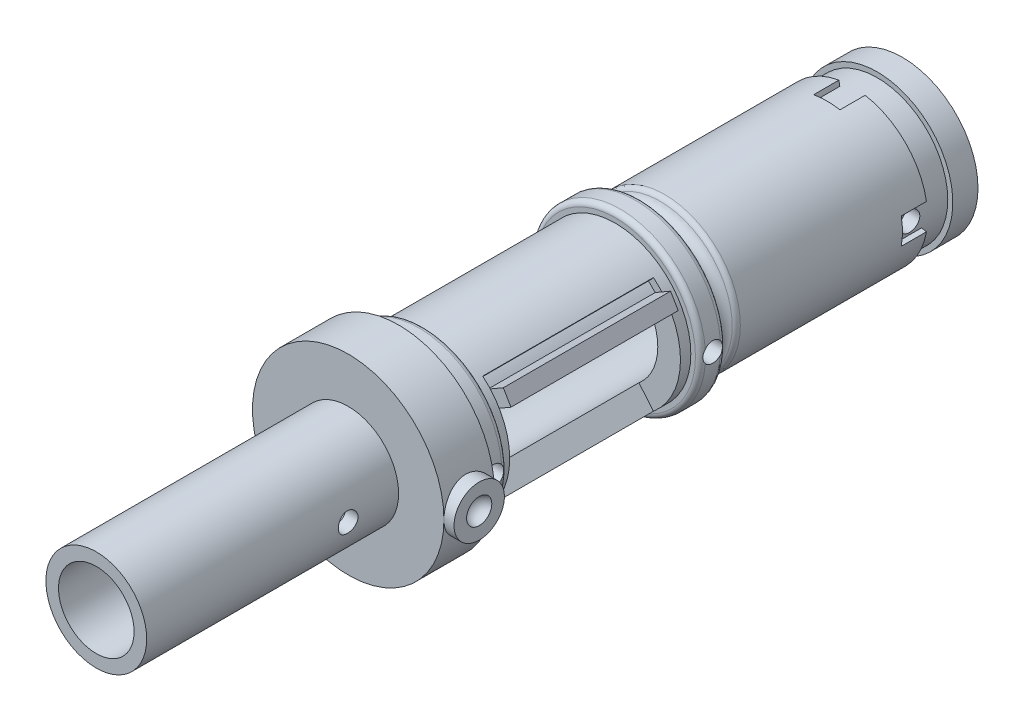
from build123d import *
from build123d.topology import SkipClean

# Parameters (mm, degrees)
ESQUISSE1_R                                   = 15
ESQUISSE1_R_2                                 = 10.5
BOSS_EXTRU_3_DEPTH                            = 100
ESQUISSE9_W                                   = 5
ESQUISSE9_H                                   = 2
ENL_VEMENT_START                              = 10
ENL_VEMENT_DE_MATI_RE_R_VOLUTION2_DEPTH       = 5
R_P_TITION_CIRCULAIRE1_COUNT                  = 4
ESQUISSE11_R                                  = 2
ESQUISSE12_W                                  = 4
ESQUISSE12_H                                  = 5
ESQUISSE13_W                                  = 3
ESQUISSE13_H                                  = 5
CONG_2_R                                      = 1
CONG_3_R                                      = 1
CONG_4_R                                      = 1
CONG_5_R                                      = 1
ENL_V_MAT_EXTRU_2_DEPTH                       = 103.824588457
ENL_V_MAT_EXTRU_2_DEPTH_BACK                  = 103.824588457
ESQUISSE16_R                                  = 1.95
ESQUISSE19_W                                  = 13.434398634
ESQUISSE19_H                                  = 33.894617108
ENL_VEMENT_DE_MATI_RE_R_VOLUTION4_ANGLE       = 50
ENL_VEMENT_DE_MATI_RE_R_VOLUTION4_OTHER_ANGLE = 50
ESQUISSE20_W                                  = 33.894617108
ESQUISSE20_H                                  = 2.5
ESQUISSE25_R                                  = 1.95
ENL_V_MAT_EXTRU_3_DEPTH                       = 103.824588457
BOSS_EXTRU_4_DEPTH                            = 33.894617109
ESQUISSE29_W                                  = 33.894617108
ESQUISSE29_H                                  = 3.1234995
ENL_VEMENT_DE_MATI_RE_R_VOLUTION7_ANGLE       = 100
ESQUISSE32_W                                  = 33.2
ESQUISSE32_H                                  = 2.5
R_VOLUTION4_ANGLE                             = 20
R_VOLUTION4_OTHER_WAY_ANGLE                   = 90
BOSS_EXTRU_5_DEPTH                            = 4
BOSS_EXTRU_5_DEPTH_BACK                       = 1
ESQUISSE34_W                                  = 3
ESQUISSE34_H                                  = 33.2
ESQUISSE35_R                                  = 19
BOSS_EXTRU_6_DEPTH                            = 10
ESQUISSE36_R                                  = 10
ESQUISSE36_R_2                                = 7.5
BOSS_EXTRU_7_DEPTH                            = 50
ESQUISSE39_R                                  = 5
BOSS_EXTRU_8_DEPTH                            = 21
ENL_V_MAT_EXTRU_4_DEPTH                       = 163.486922575
ENL_V_MAT_EXTRU_4_DEPTH_BACK                  = 163.486922575
ESQUISSE42_R                                  = 1.95


# Read off the part's stored shape, not the designer's step: Enlèvement de matière-Révolution2, Boss.-Extru.4
with BuildPart() as part:
    # Esquisse1 → Boss.-Extru.3 (new body)
    with BuildSketch(Plane.XY):
        Circle(ESQUISSE1_R)
        Circle(ESQUISSE1_R_2, mode=Mode.SUBTRACT)
    extrude(amount=BOSS_EXTRU_3_DEPTH)

    # Esquisse9 → Enlèvement de matière-Révolution1 (revolve, cut)
    with BuildSketch(Plane(origin=(0, 0, 0), x_dir=(0, 0, -1), z_dir=(1, 0, 0)), mode=Mode.PRIVATE) as enl_vement_de_mati_re_r_volution1_sk:
        with Locations((-7.5, -15)):
            Rectangle(ESQUISSE9_W, ESQUISSE9_H)
    revolve(enl_vement_de_mati_re_r_volution1_sk.sketch.rotate(Axis((0, 0, 100), (0, 0, -1)), 270), axis=Axis((0, 0, 100), (0, 0, -1)), mode=Mode.SUBTRACT)

    # Enlèvement de matière-Révolution2 outlin → Enlèvement de matière-Révolution2 (cut)
    with BuildSketch(Plane.XY.offset(ENL_VEMENT_START)):
        with BuildLine():
            Line((-2.431074487, -13.787308542), (-2.604722665, -14.772116295))
            ThreePointArc((-2.604722665, -14.772116295), (0, -15), (2.604722665, -14.772116295))
            Line((2.604722665, -14.772116295), (2.431074487, -13.787308542))
            ThreePointArc((2.431074487, -13.787308542), (0, -14), (-2.431074487, -13.787308542))
        make_face()
    enl_vement_de_mati_re_r_volution2 = extrude(amount=ENL_VEMENT_DE_MATI_RE_R_VOLUTION2_DEPTH, mode=Mode.SUBTRACT)

    # Répétition circulaire1: Enlèvement de matière-Révolution2 ×4 about axis
    r_p_tition_circulaire1_axis = Axis((0, 0, 0), (0, 0, 1))
    for i in range(1, R_P_TITION_CIRCULAIRE1_COUNT):
        add(enl_vement_de_mati_re_r_volution2.rotate(r_p_tition_circulaire1_axis, i * 360 / R_P_TITION_CIRCULAIRE1_COUNT), mode=Mode.SUBTRACT)

    # Esquisse11 → Enlèvement de matière-Révolution3 (revolve, cut)
    with BuildSketch(Plane(origin=(0, 0, 0), x_dir=(1, 0, 0), z_dir=(0, 1, 0)), mode=Mode.PRIVATE) as enl_vement_de_mati_re_r_volution3_sk:
        with Locations((15, -50)):
            Circle(ESQUISSE11_R)
    revolve(enl_vement_de_mati_re_r_volution3_sk.sketch.rotate(Axis((0, 0, 100), (0, 0, -1)), 190), axis=Axis((0, 0, 100), (0, 0, -1)), mode=Mode.SUBTRACT)

    # Esquisse12 → Révolution1 (revolve)
    with BuildSketch(Plane(origin=(0, 0, 0), x_dir=(1, 0, 0), z_dir=(0, 1, 0))):
        with Locations((14.924774562, -54.5)):
            Rectangle(ESQUISSE12_W, ESQUISSE12_H)
    revolve(axis=Axis((0, 0, 100), (0, 0, -1)))

    # Esquisse13 → Révolution2 (revolve)
    with BuildSketch(Plane(origin=(0, 0, 0), x_dir=(1, 0, 0), z_dir=(0, 1, 0)), mode=Mode.PRIVATE) as r_volution2_sk:
        with Locations((15, -97.5)):
            Rectangle(ESQUISSE13_W, ESQUISSE13_H)
    revolve(r_volution2_sk.sketch.rotate(Axis((0, 0, 100), (0, 0, -1)), 190), axis=Axis((0, 0, 100), (0, 0, -1)))

    # Congé2
    cong_2_edges = [part.edges().sort_by_distance(p)[0] for p in [
        (-16.924774562, 0, 52),
    ]]
    fillet(cong_2_edges, radius=CONG_2_R)

    # Congé3
    cong_3_edges = [part.edges().sort_by_distance(p)[0] for p in [
        (-16.924774562, 0, 57),
    ]]
    fillet(cong_3_edges, radius=CONG_3_R)

    # Congé4
    cong_4_edges = [part.edges().sort_by_distance(p)[0] for p in [
        (16.249327925, -2.865194932, 95),
        (16.249327925, -2.865194932, 100),
    ]]
    fillet(cong_4_edges, radius=CONG_4_R)

    # Congé5
    cong_5_edges = [part.edges().sort_by_distance(p)[0] for p in [
        (-1.307336141, -14.942920471, 48),
    ]]
    fillet(cong_5_edges, radius=CONG_5_R)

    # Esquisse16 → Enlèv. mat.-Extru.2 (cut, two sides: drawn at the far end of the back side and taken through both)
    with SkipClean():  # the faces are left unmerged after this step: merging them gives an invalid solid
        with BuildSketch(Plane(origin=(0, 0, 0), x_dir=(0, 0, -1), z_dir=(1, 0, 0)).offset(-ENL_V_MAT_EXTRU_2_DEPTH_BACK)):
            with Locations((-12.5, 0)):
                Circle(ESQUISSE16_R)
        extrude(amount=ENL_V_MAT_EXTRU_2_DEPTH + ENL_V_MAT_EXTRU_2_DEPTH_BACK, mode=Mode.SUBTRACT)

    # Esquisse19 → Enlèvement de matière-Révolution4 (revolve, cut)
    with SkipClean():  # the faces are left unmerged after this step: merging them gives an invalid solid
        with BuildSketch(Plane(origin=(0, 0, 0), x_dir=(1, 0, 0), z_dir=(0, 1, 0))):
            with Locations((15, -76)):
                Rectangle(ESQUISSE19_W, ESQUISSE19_H)
        revolve(axis=Axis((0, 0, 100), (0, 0, -1)), revolution_arc=ENL_VEMENT_DE_MATI_RE_R_VOLUTION4_ANGLE, mode=Mode.SUBTRACT)

    # Esquisse19 → Enlèvement de matière-Révolution4 other (revolve, cut)
    with SkipClean():  # the faces are left unmerged after this step: merging them gives an invalid solid
        with BuildSketch(Plane(origin=(0, 0, 0), x_dir=(1, 0, 0), z_dir=(0, 1, 0))):
            with Locations((15, -76)):
                Rectangle(ESQUISSE19_W, ESQUISSE19_H)
        revolve(axis=Axis((0, 0, 100), (0, 0, 1)), revolution_arc=ENL_VEMENT_DE_MATI_RE_R_VOLUTION4_OTHER_ANGLE, mode=Mode.SUBTRACT)

    # Esquisse20 → Enlèvement de matière-Révolution5 (revolve, cut)
    with SkipClean():  # the faces are left unmerged after this step: merging them gives an invalid solid
        with BuildSketch(Plane(origin=(0, 0, 0), x_dir=(0, 0, -1), z_dir=(0.7660444431189791, 0.6427876096865379, 0)), mode=Mode.PRIVATE) as enl_vement_de_mati_re_r_volution5_sk:
            with Locations((-76, -10.5)):
                Rectangle(ESQUISSE20_W, ESQUISSE20_H)
        revolve(enl_vement_de_mati_re_r_volution5_sk.sketch.rotate(Axis((0, 0, 100), (0, 0, -1)), 140), axis=Axis((0, 0, 100), (0, 0, -1)), mode=Mode.SUBTRACT)

    # Esquisse25 → Enlèv. mat.-Extru.3 (cut, through all)
    with SkipClean():  # the faces are left unmerged after this step: merging them gives an invalid solid
        with BuildSketch(Plane(origin=(0, 0, 0), x_dir=(0, 0, -1), z_dir=(1, 0, 0))):
            with Locations(Location((-97.5, 0, 0), (0, 0, 180))):
                Circle(ESQUISSE25_R)
            with Locations(Location((-54.5, 0, 0), (0, 0, 180))):
                Circle(ESQUISSE25_R)
        extrude(amount=ENL_V_MAT_EXTRU_3_DEPTH, mode=Mode.SUBTRACT)

    # Boss.-Extru.4 outline → Boss.-Extru.4 (add)
    with SkipClean():  # the faces are left unmerged after this step: merging them gives an invalid solid
        with BuildSketch(Plane.XY.offset(59.052691446)):
            with BuildLine():
                ThreePointArc((6.749269902, -8.043466653), (-10.5, 0), (6.749269902, 8.043466653))
                Line((6.749269902, 8.043466653), (7.552754414, 9.001022207))
                ThreePointArc((7.552754414, 9.001022207), (-11.75, 0), (7.552754414, -9.001022207))
                Line((7.552754414, -9.001022207), (6.749269902, -8.043466653))
            make_face()
        extrude(amount=BOSS_EXTRU_4_DEPTH)

    # Esquisse29 → Enlèvement de matière-Révolution7 (revolve, cut)
    with SkipClean():  # the faces are left unmerged after this step: merging them gives an invalid solid
        with BuildSketch(Plane(origin=(0, 0, 0), x_dir=(0, 0, -1), z_dir=(0.7660444431189792, -0.6427876096865379, 0))):
            with Locations((-76, 12.75)):
                Rectangle(ESQUISSE29_W, ESQUISSE29_H)
        revolve(axis=Axis((0, 0, 100), (0, 0, 1)), revolution_arc=ENL_VEMENT_DE_MATI_RE_R_VOLUTION7_ANGLE, mode=Mode.SUBTRACT)

    # Esquisse35 → Boss.-Extru.6 (add)
    with SkipClean():  # the faces are left unmerged after this step: merging them gives an invalid solid
        with BuildSketch(Plane.XY.offset(100)):
            Circle(ESQUISSE35_R)
        extrude(amount=BOSS_EXTRU_6_DEPTH)

    # Esquisse36 → Boss.-Extru.7 (add)
    with SkipClean():  # the faces are left unmerged after this step: merging them gives an invalid solid
        with BuildSketch(Plane.XY.offset(110)):
            Circle(ESQUISSE36_R)
            Circle(ESQUISSE36_R_2, mode=Mode.SUBTRACT)
        extrude(amount=BOSS_EXTRU_7_DEPTH)

    # Esquisse39 → Boss.-Extru.8 (add)
    with SkipClean():  # the faces are left unmerged after this step: merging them gives an invalid solid
        with BuildSketch(Plane(origin=(0, 0, 0), x_dir=(0, 0, -1), z_dir=(1, 0, 0))):
            with Locations((-105, 0)):
                Circle(ESQUISSE39_R)
        extrude(amount=BOSS_EXTRU_8_DEPTH)

    # Esquisse40 → Enlèvement de matière-Révolution9 (revolve, cut)
    with SkipClean():  # the faces are left unmerged after this step: merging them gives an invalid solid
        with BuildSketch(Plane(origin=(21, 0, 0), x_dir=(0, 0, -1), z_dir=(1, 0, 0))):
            with BuildLine():
                Line((-107.5, 0), (-102.5, 0))
                ThreePointArc((-102.5, 0), (-105, -2.5), (-107.5, 0))
            make_face()
        revolve(axis=Axis((21, 0, 107.5), (0, 0, -1)), mode=Mode.SUBTRACT)

    # Esquisse42 → Enlèv. mat.-Extru.4 (cut, two sides: drawn at the far end of the back side and taken through both)
    with SkipClean():  # the faces are left unmerged after this step: merging them gives an invalid solid
        with BuildSketch(Plane(origin=(0, 0, 0), x_dir=(0, 0, -1), z_dir=(1, 0, 0)).offset(-ENL_V_MAT_EXTRU_4_DEPTH_BACK)):
            with Locations((-120, 0)):
                Circle(ESQUISSE42_R)
        extrude(amount=ENL_V_MAT_EXTRU_4_DEPTH + ENL_V_MAT_EXTRU_4_DEPTH_BACK, mode=Mode.SUBTRACT)


with BuildPart() as body_2:
    # Esquisse32 → Révolution4 (revolve)
    with BuildSketch(Plane(origin=(0, 0, 0), x_dir=(0, 0, -1), z_dir=(0.7660444431189792, -0.6427876096865379, 0))):
        with Locations((-76, 12.75)):
            Rectangle(ESQUISSE32_W, ESQUISSE32_H)
    revolve(axis=Axis((0, 0, 100), (0, 0, -1)), revolution_arc=R_VOLUTION4_ANGLE)

    # Esquisse32 → Révolution4 other way (revolve)
    with BuildSketch(Plane(origin=(0, 0, 0), x_dir=(0, 0, -1), z_dir=(0.7660444431189792, -0.6427876096865379, 0))):
        with Locations((-76, 12.75)):
            Rectangle(ESQUISSE32_W, ESQUISSE32_H)
    revolve(axis=Axis((0, 0, 100), (0, 0, 1)), revolution_arc=R_VOLUTION4_OTHER_WAY_ANGLE)

    # Esquisse34 → Boss.-Extru.5 (add, two sides: drawn at the far end of the back side and taken through both)
    with BuildSketch(Plane(origin=(11.428132998, 6.598035663, 0), x_dir=(-0.5000000000000011, 0.8660254037844382, -9.071134608832366e-15), z_dir=(0.8660254037844382, 0.5000000000000011, 1.7457406694215556e-15)).offset(-BOSS_EXTRU_5_DEPTH_BACK)):
        with Locations((1.5, 76)):
            Rectangle(ESQUISSE34_W, ESQUISSE34_H)
    extrude(amount=BOSS_EXTRU_5_DEPTH + BOSS_EXTRU_5_DEPTH_BACK)


solid = Compound([part.part, body_2.part])
